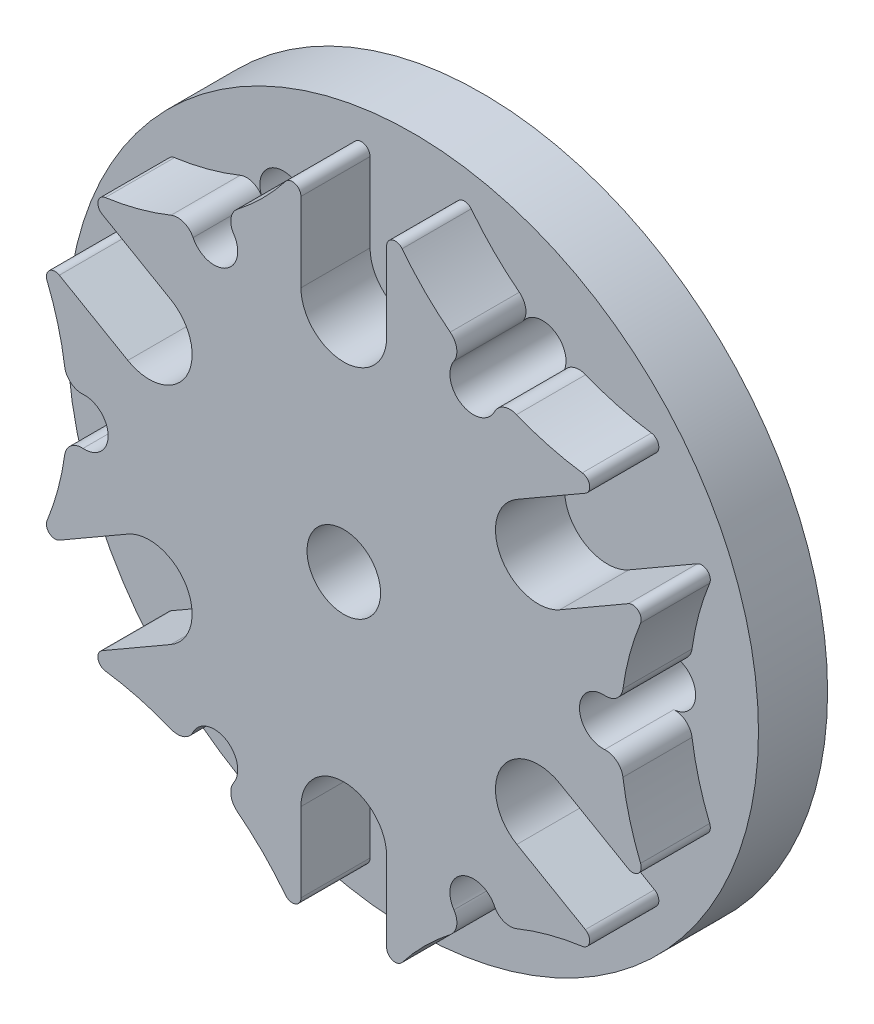
from build123d import *

# Parameters (mm, degrees)
SKETCH2_R           = 31.75
BOSS_EXTRUDE1_DEPTH = 6.35
BOSS_EXTRUDE2_DEPTH = 6.35
SKETCH4_R           = 3.3782
CUT_EXTRUDE1_DEPTH  = 47.6627796
FILLET2_R           = 0.79375
SKETCH5_R           = 2.159
CUT_EXTRUDE2_DEPTH  = 47.6627796
FILLET3_R           = 1.5875


with BuildPart() as part:
    # Sketch2 → Boss-Extrude1 (new body)
    with BuildSketch(Plane.XY):
        Circle(SKETCH2_R)
    extrude(amount=BOSS_EXTRUDE1_DEPTH)

    # Sketch3 → Boss-Extrude2 (add)
    with BuildSketch(Plane.XY.offset(6.35)):
        with BuildLine():
            Line((3.937, 30.411026388), (3.937, 20.6375))
            ThreePointArc((3.937, 20.6375), (0, 16.7005), (-3.937, 20.6375))
            Line((-3.937, 20.6375), (-3.937, 30.411026388))
            ThreePointArc((-3.937, 30.411026388), (-12.7, 21.997045256), (-24.368221407, 18.615055209))
            Line((-24.368221407, 18.615055209), (-15.904099271, 13.728292015))
            ThreePointArc((-15.904099271, 13.728292015), (-14.463057256, 8.35025), (-19.841099271, 6.909207985))
            Line((-19.841099271, 6.909207985), (-28.305221407, 11.795971179))
            ThreePointArc((-28.305221407, 11.795971179), (-25.4, 0), (-28.305221407, -11.795971179))
            Line((-28.305221407, -11.795971179), (-19.841099271, -6.909207985))
            ThreePointArc((-19.841099271, -6.909207985), (-14.463057256, -8.35025), (-15.904099271, -13.728292015))
            Line((-15.904099271, -13.728292015), (-24.368221407, -18.615055209))
            ThreePointArc((-24.368221407, -18.615055209), (-12.7, -21.997045256), (-3.937, -30.411026388))
            Line((-3.937, -30.411026388), (-3.937, -20.6375))
            ThreePointArc((-3.937, -20.6375), (0, -16.7005), (3.937, -20.6375))
            Line((3.937, -20.6375), (3.937, -30.411026388))
            ThreePointArc((3.937, -30.411026388), (12.7, -21.997045256), (24.368221407, -18.615055209))
            Line((24.368221407, -18.615055209), (15.904099271, -13.728292015))
            ThreePointArc((15.904099271, -13.728292015), (14.463057256, -8.35025), (19.841099271, -6.909207985))
            Line((19.841099271, -6.909207985), (28.305221407, -11.795971179))
            ThreePointArc((28.305221407, -11.795971179), (25.4, 0), (28.305221407, 11.795971179))
            Line((28.305221407, 11.795971179), (19.841099271, 6.909207985))
            ThreePointArc((19.841099271, 6.909207985), (14.463057256, 8.35025), (15.904099271, 13.728292015))
            Line((15.904099271, 13.728292015), (24.368221407, 18.615055209))
            ThreePointArc((24.368221407, 18.615055209), (12.7, 21.997045256), (3.937, 30.411026388))
        make_face()
    extrude(amount=BOSS_EXTRUDE2_DEPTH)

    # Sketch4 → Cut-Extrude1 (cut, through all)
    with BuildSketch(Plane.XY.offset(12.7)):
        Circle(SKETCH4_R)
    extrude(amount=-CUT_EXTRUDE1_DEPTH, mode=Mode.SUBTRACT)

    # Fillet2
    fillet2_edges = [part.edges().sort_by_distance(p)[0] for p in [
        (-28.305221407, 11.795971179, 9.525),
        (-28.305221407, -11.795971179, 9.525),
        (-24.368221407, -18.615055209, 9.525),
        (-3.937, -30.411026388, 9.525),
        (3.937, -30.411026388, 9.525),
        (24.368221407, -18.615055209, 9.525),
        (28.305221407, -11.795971179, 9.525),
        (28.305221407, 11.795971179, 9.525),
        (24.368221407, 18.615055209, 9.525),
        (3.937, 30.411026388, 9.525),
        (-3.937, 30.411026388, 9.525),
        (-24.368221407, 18.615055209, 9.525),
    ]]
    fillet(fillet2_edges, radius=FILLET2_R)

    # Sketch5 → Cut-Extrude2 (cut, through all)
    with BuildSketch(Plane(origin=(0, 0, 0), x_dir=(-1, 0, 0), z_dir=(0, 0, -1))):
        with Locations((-11.90625, 20.622229928)):
            Circle(SKETCH5_R)
        with Locations((11.90625, 20.622229928)):
            Circle(SKETCH5_R)
        with Locations((23.8125, 0)):
            Circle(SKETCH5_R)
        with Locations((11.90625, -20.622229928)):
            Circle(SKETCH5_R)
        with Locations((-11.90625, -20.622229928)):
            Circle(SKETCH5_R)
        with Locations((-23.8125, 0)):
            Circle(SKETCH5_R)
    extrude(amount=-CUT_EXTRUDE2_DEPTH, mode=Mode.SUBTRACT)

    # Fillet3
    # the kernel refuses this fillet: 1.5875 mm, written as the material it takes off along each edge
    with BuildSketch(Plane(origin=(25.439668824, 1.419014665, 17.971488678), x_dir=(-0.895364972347459, 0.44533309588804865, 0), z_dir=(0, 0, -1)), Plane(origin=(13.94873716, -21.321892132, 17.971488678), x_dir=(-0.062012711988979966, 0.9980753596556584, 0), z_dir=(0, 0, -1)), Plane(origin=(-11.490931663, -22.740906798, 17.971488678), x_dir=(0.8333522603583425, 0.5527422637682424, 0), z_dir=(0, 0, -1)), Plane(origin=(-25.439668824, -1.419014665, 17.971488678), x_dir=(0.895364972347876, -0.44533309588721026, 0), z_dir=(0, 0, -1)), Plane(origin=(-13.94873716, 21.321892132, 17.971488678), x_dir=(0.06201271198937459, -0.998075359655634, 0), z_dir=(0, 0, -1)), Plane(origin=(11.490931663, 22.740906798, 17.971488678), x_dir=(-0.8333522603586354, -0.552742263767801, 0), z_dir=(0, 0, -1))) as fillet3_piece_1:
        with BuildLine():
            CenterArc((2.256551384, 1.467035409), FILLET3_R, 161.515751163, 86.019798363)
            ThreePointArc((0.75094916, 1.970342665), (0.395929534, 0.977375414), (0, 0))
            ThreePointArc((0, 0), (0.824975775, 0.163831844), (1.64995155, 0))
        make_face()
    extrude(amount=11.621488678, mode=Mode.SUBTRACT)
    with BuildSketch(Plane(origin=(25.439668824, -1.419014665, 17.971488678), x_dir=(0.09726153154123053, -0.9952588580275255, 0), z_dir=(0, 0, -1)), Plane(origin=(11.490931663, -22.740906798, 17.971488678), x_dir=(-0.8132886886226861, -0.581860386139486, 0), z_dir=(0, 0, -1)), Plane(origin=(-13.94873716, -21.321892132, 17.971488678), x_dir=(-0.9105502201639705, 0.4133984718880138, 0), z_dir=(0, 0, -1)), Plane(origin=(-25.439668824, 1.419014665, 17.971488678), x_dir=(-0.09726153154127945, 0.9952588580275207, 0), z_dir=(0, 0, -1)), Plane(origin=(-11.490931663, 22.740906798, 17.971488678), x_dir=(0.8132886886227111, 0.5818603861394509, 0), z_dir=(0, 0, -1)), Plane(origin=(13.94873716, 21.321892132, 17.971488678), x_dir=(0.9105502201639343, -0.41339847188809375, 0), z_dir=(0, 0, -1))) as fillet3_piece_2:
        with BuildLine():
            CenterArc((2.17448908, 1.586131862), FILLET3_R, 181.601297313, 86.019798363)
            ThreePointArc((0.587609026, 1.541770329), (0.446894509, 0.71253856), (0, 0))
            ThreePointArc((0, 0), (1.054297736, 0.021890215), (2.108595471, 0))
        make_face()
    extrude(amount=11.621488678, mode=Mode.SUBTRACT)


solid = part.part
